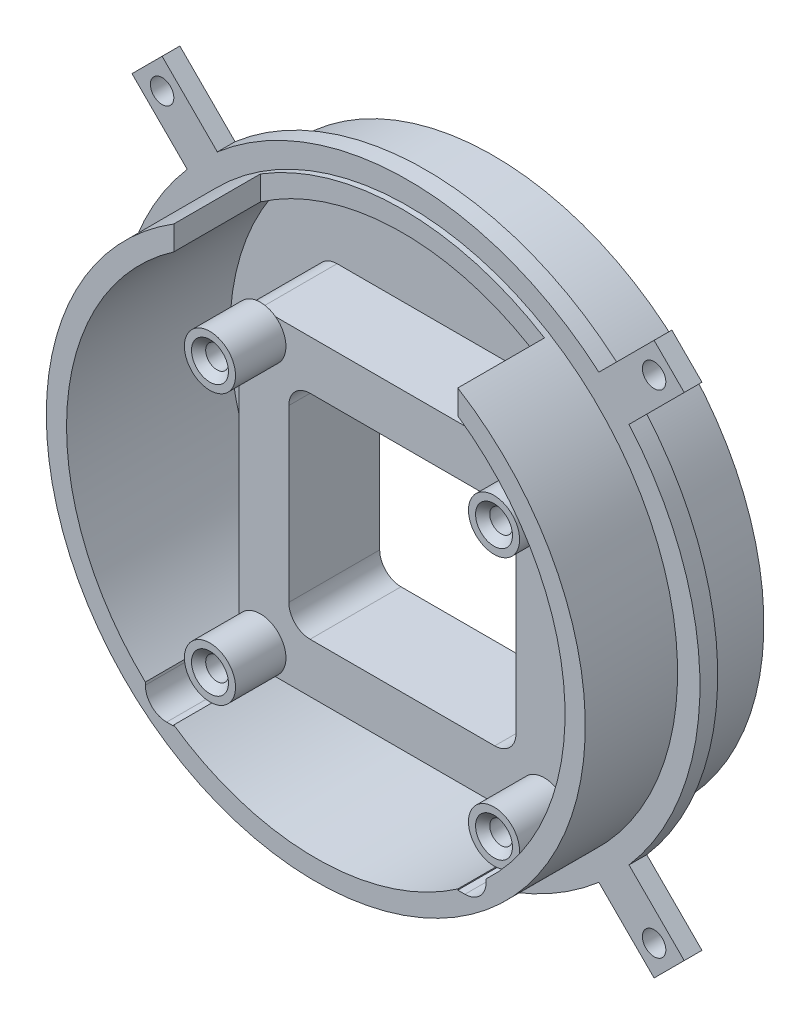
from build123d import *

# Parameters (mm, degrees)
BOSS_EXTRUDE1_DEPTH     = 10.8
CUT_EXTRUDE1_DEPTH      = 63.509359299
CUT_EXTRUDE1_DEPTH_BACK = 63.509359299
SKETCH14_W              = 32
SKETCH14_H              = 30
CUT_EXTRUDE3_DEPTH      = 60.51688836
FILLET1_R               = 3
SKETCH16_R              = 1.6
CUT_EXTRUDE2_DEPTH      = 60.51688836
CUT_EXTRUDE4_DEPTH      = 75.590213715
BOSS_EXTRUDE3_START     = -2.5
BOSS_EXTRUDE3_OUTLINE_R = 1.65
BOSS_EXTRUDE3_DEPTH     = 2.5
BOSS_EXTRUDE4_START     = 7.1
SKETCH24_R              = 3.6
SKETCH24_R_2            = 1.6
BOSS_EXTRUDE4_DEPTH     = 7.1
CHAMFER1_SIZE           = 1


# Read off the part's stored shape, not the designer's step: Boss-Extrude3
with BuildPart() as part:
    # Sketch6 → Revolve1 (revolve)
    with BuildSketch(Plane(origin=(0, 0, 0), x_dir=(0, 0, -1), z_dir=(1, 0, 0)), mode=Mode.PRIVATE) as revolve1_sk:
        Polygon((-2, 25.4), (-2, 35.1), (-25, 35.1), (-25, 37.95), (-12, 37.95), (-12, 41.1), (-9.5, 41.1), (-9.5, 38.1), (0, 38.1), (0, 25.4), (0, 0), (-2, 0), align=None)
    revolve(revolve1_sk.sketch.rotate(Axis((0, 0, 0), (0, 0, 1)), 90), axis=Axis((0, 0, 0), (0, 0, 1)))

    # Sketch15 → Boss-Extrude1 (add)
    with BuildSketch(Plane.XY.offset(2)):
        with BuildLine():
            Line((-20, 15.904297927), (20, 15.904297927))
            ThreePointArc((20, 15.904297927), (22.121320344, 15.02561827), (23, 12.904297927))
            Line((23, 12.904297927), (23, -24.995702073))
            ThreePointArc((23, -24.995702073), (22.121320344, -27.117022417), (20, -27.995702073))
            Line((20, -27.995702073), (-20, -27.995702073))
            ThreePointArc((-20, -27.995702073), (-22.121320344, -27.117022417), (-23, -24.995702073))
            Line((-23, -24.995702073), (-23, 12.904297927))
            ThreePointArc((-23, 12.904297927), (-22.121320344, 15.02561827), (-20, 15.904297927))
        make_face()
    extrude(amount=BOSS_EXTRUDE1_DEPTH)

    # Sketch14 → Cut-Extrude1 (cut, two sides: drawn at the far end of the back side and taken through both)
    with BuildSketch(Plane.XY.offset(2).offset(-CUT_EXTRUDE1_DEPTH_BACK)):
        with Locations((-0.00164643, -5.995702073)):
            Rectangle(SKETCH14_W, SKETCH14_H)
    extrude(amount=CUT_EXTRUDE1_DEPTH + CUT_EXTRUDE1_DEPTH_BACK, mode=Mode.SUBTRACT)

    # Sketch18 → Cut-Extrude3 (cut, through all)
    with BuildSketch(Plane.XY.offset(12.8)):
        with BuildLine():
            Line((19.99835357, -24.995702073), (23.99835357, -24.995702073))
            Line((23.99835357, -24.995702073), (23.99835357, -25.995702073))
            ThreePointArc((23.99835357, -25.995702073), (23.119673914, -28.117022417), (20.99835357, -28.995702073))
            Line((20.99835357, -28.995702073), (19.99835357, -28.995702073))
            Line((19.99835357, -28.995702073), (19.99835357, -24.995702073))
        make_face()
        with BuildLine():
            Line((-20.00164643, -24.995702073), (-24.00164643, -24.995702073))
            Line((-24.00164643, -24.995702073), (-24.00164643, -25.995702073))
            ThreePointArc((-24.00164643, -25.995702073), (-23.122966774, -28.117022417), (-21.00164643, -28.995702073))
            Line((-21.00164643, -28.995702073), (-20.00164643, -28.995702073))
            Line((-20.00164643, -28.995702073), (-20.00164643, -24.995702073))
        make_face()
    extrude(amount=CUT_EXTRUDE3_DEPTH, mode=Mode.SUBTRACT)

    # Fillet1
    fillet1_edges = [part.edges().sort_by_distance(p)[0] for p in [
        (-16.00164643, 9.004297927, 6.4),
        (-16.00164643, -20.995702073, 6.4),
        (15.99835357, -20.995702073, 6.4),
        (15.99835357, 9.004297927, 6.4),
    ]]
    fillet(fillet1_edges, radius=FILLET1_R)

    # Sketch16 → Cut-Extrude2 (cut, through all)
    with BuildSketch(Plane.XY.offset(12.8)):
        with Locations((-20.00164643, 13.004297927)):
            Circle(SKETCH16_R)
        with Locations((-20.00164643, -24.995702073)):
            Circle(SKETCH16_R)
        with Locations((19.99835357, -24.995702073)):
            Circle(SKETCH16_R)
        with Locations((19.99835357, 13.004297927)):
            Circle(SKETCH16_R)
    extrude(amount=-CUT_EXTRUDE2_DEPTH, mode=Mode.SUBTRACT)

    # Sketch20 → Cut-Extrude4 (cut, through all)
    with BuildSketch(Plane(origin=(0, 15.904297927, 0), x_dir=(1, 0, 0), z_dir=(0, 1, 0))):
        Polygon((20, -12.8), (-20, -12.8), (-20, -25), (19.99835357, -25), align=None)
    extrude(amount=CUT_EXTRUDE4_DEPTH, mode=Mode.SUBTRACT)

    # Boss-Extrude3 outline → Boss-Extrude3 (add)
    # profile 1 of 2: a face of its own
    with BuildSketch(Plane.XY.offset(12).offset(BOSS_EXTRUDE3_START)):
        with BuildLine():
            Line((-26.863244514, 31.105885201), (-34.641419107, 38.884059794))
            Line((-34.641419107, 38.884059794), (-38.884059794, 34.641419107))
            Line((-38.884059794, 34.641419107), (-31.105885201, 26.863244514))
            ThreePointArc((-31.105885201, 26.863244514), (-29.062088707, 29.062088707), (-26.863244514, 31.105885201))
        make_face()
        with Locations((-34.641419107, 34.641419107)):
            Circle(BOSS_EXTRUDE3_OUTLINE_R, mode=Mode.SUBTRACT)
    # profile 2 of 2: a face of its own
    with BuildSketch(Plane.XY.offset(12).offset(BOSS_EXTRUDE3_START)):
        with BuildLine():
            Line((34.641419107, 38.884059794), (26.863244514, 31.105885201))
            ThreePointArc((26.863244514, 31.105885201), (29.062088707, 29.062088707), (31.105885201, 26.863244514))
            Line((31.105885201, 26.863244514), (38.884059794, 34.641419107))
            Line((38.884059794, 34.641419107), (34.641419107, 38.884059794))
        make_face()
        with Locations((34.641419107, 34.641419107)):
            Circle(BOSS_EXTRUDE3_OUTLINE_R, mode=Mode.SUBTRACT)
    boss_extrude3 = extrude(amount=BOSS_EXTRUDE3_DEPTH)

    # Sketch24 → Boss-Extrude4 (add)
    # profile 1 of 4: a face of its own
    with BuildSketch(Plane.XY.offset(12.8).offset(BOSS_EXTRUDE4_START)):
        with Locations(Location((-20.00164643, 13.004297927, 0), (0, 0, 213.6046846))):
            Circle(SKETCH24_R)
        with Locations((-20.00164643, 13.004297927)):
            Circle(SKETCH24_R_2, mode=Mode.SUBTRACT)
    # profile 2 of 4: a face of its own
    with BuildSketch(Plane.XY.offset(12.8).offset(BOSS_EXTRUDE4_START)):
        with Locations(Location((19.99835357, 13.004297927, 0), (0, 0, 126.336057515))):
            Circle(SKETCH24_R)
        with Locations((19.99835357, 13.004297927)):
            Circle(SKETCH24_R_2, mode=Mode.SUBTRACT)
    # profile 3 of 4: a face of its own
    with BuildSketch(Plane.XY.offset(12.8).offset(BOSS_EXTRUDE4_START)):
        with Locations(Location((-20.00164643, -24.995702073, 0), (0, 0, 198.741091164))):
            Circle(SKETCH24_R)
        with Locations((-20.00164643, -24.995702073)):
            Circle(SKETCH24_R_2, mode=Mode.SUBTRACT)
    # profile 4 of 4: a face of its own
    with BuildSketch(Plane.XY.offset(12.8).offset(BOSS_EXTRUDE4_START)):
        with Locations(Location((19.99835357, -24.995702073, 0), (0, 0, 236.442690237))):
            Circle(SKETCH24_R)
        with Locations((19.99835357, -24.995702073)):
            Circle(SKETCH24_R_2, mode=Mode.SUBTRACT)
    extrude(amount=-BOSS_EXTRUDE4_DEPTH)

    # Chamfer1
    chamfer1_edges = [part.edges().sort_by_distance(p)[0] for p in [
        (-21.60164643, 13.004297927, 19.9),
        (18.39835357, 13.004297927, 19.9),
        (-21.60164643, -24.995702073, 19.9),
        (18.39835357, -24.995702073, 19.9),
    ]]
    chamfer(chamfer1_edges, length=CHAMFER1_SIZE)

    # Mirror1: Boss-Extrude3 across plane
    add(boss_extrude3.mirror(Plane.ZX))


solid = part.part
